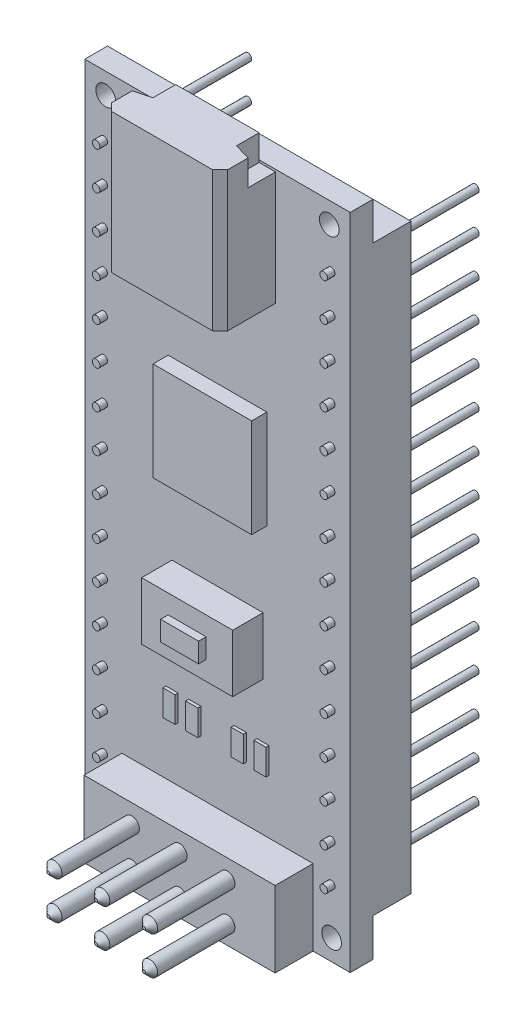
from build123d import *

# Parameters (mm, degrees)
ESQUISSE1_W             = 17.5
ESQUISSE1_H             = 43.4
BOSS_EXTRU_1_DEPTH      = 1.5
ESQUISSE2_W             = 7.65
ESQUISSE2_H             = 9.2
BOSS_EXTRU_2_DEPTH      = 3.65
ESQUISSE3_W             = 12.6
ESQUISSE3_H             = 5
BOSS_EXTRU_3_DEPTH      = 2.5
ESQUISSE4_W             = 2.5
ESQUISSE4_H             = 38.4
BOSS_EXTRU_4_DEPTH      = 2.5
BOSS_EXTRU_5_DEPTH      = 5.5
BOSS_EXTRU_5_DEPTH_BACK = 4.5
ESQUISSE5_R             = 0.25
ESQUISSE6_W             = 6.5
ESQUISSE6_H             = 6.5
BOSS_EXTRU_6_DEPTH      = 1
ESQUISSE7_W             = 6
ESQUISSE7_H             = 3.8
BOSS_EXTRU_9_DEPTH      = 2
ESQUISSE8_W             = 2.5
ESQUISSE8_H             = 1.3
BOSS_EXTRU_10_DEPTH     = 0.5
ESQUISSE9_W             = 0.8
ESQUISSE9_H             = 1.7
BOSS_EXTRU_11_DEPTH     = 0.2
ESQUISSE10_R            = 0.5
BOSS_EXTRU_12_DEPTH     = 5.5
CHANFREIN1_SIZE         = 0.4
ENL_V_MAT_EXTRU_1_DEPTH = 1.7
CHANFREIN2_SIZE         = 0.5
ESQUISSE12_R            = 0.65
ENL_V_MAT_EXTRU_2_DEPTH = 5.7
ESQUISSE13_W            = 5.5
ESQUISSE13_H            = 3
ESQUISSE13_W_2          = 3.5
ESQUISSE13_H_2          = 10
ESQUISSE13_W_3          = 1
ESQUISSE13_H_3          = 2
BOSS_EXTRU_13_DEPTH     = 1


with BuildPart() as part:
    # Esquisse1 → Boss.-Extru.1 (new body)
    with BuildSketch(Plane.XY):
        with Locations((-8.75, 21.7)):
            Rectangle(ESQUISSE1_W, ESQUISSE1_H)
    extrude(amount=BOSS_EXTRU_1_DEPTH)

    # Esquisse2 → Boss.-Extru.2 (add)
    with BuildSketch(Plane.XY.offset(1.5)):
        with Locations((-8.75, 40.35)):
            Rectangle(ESQUISSE2_W, ESQUISSE2_H)
    extrude(amount=BOSS_EXTRU_2_DEPTH)

    # Esquisse3 → Boss.-Extru.3 (add)
    with BuildSketch(Plane.XY.offset(1.5)):
        with Locations((-8.75, 2.5)):
            Rectangle(ESQUISSE3_W, ESQUISSE3_H)
    extrude(amount=BOSS_EXTRU_3_DEPTH)

    # Esquisse4 → Boss.-Extru.4 (add)
    with BuildSketch(Plane(origin=(0, 0, 0), x_dir=(-1, 0, 0), z_dir=(0, 0, -1))):
        with Locations((1.25, 21.7)):
            Rectangle(ESQUISSE4_W, ESQUISSE4_H)
        with Locations((16.25, 21.7)):
            Rectangle(ESQUISSE4_W, ESQUISSE4_H)
    extrude(amount=BOSS_EXTRU_4_DEPTH)

    # Esquisse5 → Boss.-Extru.5 (add, two sides: drawn at the far end of the back side and taken through both)
    with BuildSketch(Plane(origin=(0, 0, -2.5), x_dir=(-1, 0, 0), z_dir=(0, 0, -1)).offset(-BOSS_EXTRU_5_DEPTH_BACK)):
        with Locations((16.25, 39.4)):
            Circle(ESQUISSE5_R)
        with Locations((16.25, 36.9)):
            Circle(ESQUISSE5_R)
        with Locations((16.25, 34.4)):
            Circle(ESQUISSE5_R)
        with Locations((16.25, 31.9)):
            Circle(ESQUISSE5_R)
        with Locations((16.25, 29.4)):
            Circle(ESQUISSE5_R)
        with Locations((16.25, 26.9)):
            Circle(ESQUISSE5_R)
        with Locations((16.25, 24.4)):
            Circle(ESQUISSE5_R)
        with Locations((16.25, 21.9)):
            Circle(ESQUISSE5_R)
        with Locations((16.25, 19.4)):
            Circle(ESQUISSE5_R)
        with Locations((16.25, 16.9)):
            Circle(ESQUISSE5_R)
        with Locations((16.25, 14.4)):
            Circle(ESQUISSE5_R)
        with Locations((16.25, 11.9)):
            Circle(ESQUISSE5_R)
        with Locations((16.25, 9.4)):
            Circle(ESQUISSE5_R)
        with Locations((16.25, 6.9)):
            Circle(ESQUISSE5_R)
        with Locations((16.25, 4.4)):
            Circle(ESQUISSE5_R)
        with Locations((1.25, 4.4)):
            Circle(ESQUISSE5_R)
        with Locations((1.25, 6.9)):
            Circle(ESQUISSE5_R)
        with Locations((1.25, 9.4)):
            Circle(ESQUISSE5_R)
        with Locations((1.25, 11.9)):
            Circle(ESQUISSE5_R)
        with Locations((1.25, 14.4)):
            Circle(ESQUISSE5_R)
        with Locations((1.25, 16.9)):
            Circle(ESQUISSE5_R)
        with Locations((1.25, 19.4)):
            Circle(ESQUISSE5_R)
        with Locations((1.25, 21.9)):
            Circle(ESQUISSE5_R)
        with Locations((1.25, 24.4)):
            Circle(ESQUISSE5_R)
        with Locations((1.25, 26.9)):
            Circle(ESQUISSE5_R)
        with Locations((1.25, 29.4)):
            Circle(ESQUISSE5_R)
        with Locations((1.25, 31.9)):
            Circle(ESQUISSE5_R)
        with Locations((1.25, 34.4)):
            Circle(ESQUISSE5_R)
        with Locations((1.25, 36.9)):
            Circle(ESQUISSE5_R)
        with Locations((1.25, 39.4)):
            Circle(ESQUISSE5_R)
    extrude(amount=BOSS_EXTRU_5_DEPTH + BOSS_EXTRU_5_DEPTH_BACK)

    # Esquisse6 → Boss.-Extru.6 (add)
    with BuildSketch(Plane.XY.offset(1.5)):
        with Locations((-8.75, 26)):
            Rectangle(ESQUISSE6_W, ESQUISSE6_H)
    extrude(amount=BOSS_EXTRU_6_DEPTH)

    # Esquisse7 → Boss.-Extru.9 (add)
    with BuildSketch(Plane.XY.offset(1.5)):
        with Locations((-8.75, 15.773004759)):
            Rectangle(ESQUISSE7_W, ESQUISSE7_H)
    extrude(amount=BOSS_EXTRU_9_DEPTH)

    # Esquisse8 → Boss.-Extru.10 (add)
    with BuildSketch(Plane.XY.offset(3.5)):
        with Locations((-8.75, 15.773004759)):
            Rectangle(ESQUISSE8_W, ESQUISSE8_H)
    extrude(amount=BOSS_EXTRU_10_DEPTH)

    # Esquisse9 → Boss.-Extru.11 (add)
    with BuildSketch(Plane.XY.offset(1.5)):
        with Locations((-5.75, 9.43650238)):
            Rectangle(ESQUISSE9_W, ESQUISSE9_H)
        with Locations((-10.25, 9.43650238)):
            Rectangle(ESQUISSE9_W, ESQUISSE9_H)
        with Locations((-7.25, 9.43650238)):
            Rectangle(ESQUISSE9_W, ESQUISSE9_H)
        with Locations((-11.75, 9.43650238)):
            Rectangle(ESQUISSE9_W, ESQUISSE9_H)
    extrude(amount=BOSS_EXTRU_11_DEPTH)

    # Esquisse10 → Boss.-Extru.12 (add)
    with BuildSketch(Plane.XY.offset(4)):
        with Locations((-5.6, 1.25)):
            Circle(ESQUISSE10_R)
        with Locations((-5.6, 3.75)):
            Circle(ESQUISSE10_R)
        with Locations((-8.75, 3.75)):
            Circle(ESQUISSE10_R)
        with Locations((-11.9, 3.75)):
            Circle(ESQUISSE10_R)
        with Locations((-11.9, 1.25)):
            Circle(ESQUISSE10_R)
        with Locations((-8.75, 1.25)):
            Circle(ESQUISSE10_R)
    extrude(amount=BOSS_EXTRU_12_DEPTH)

    # Chanfrein1
    chanfrein1_edges = [part.edges().sort_by_distance(p)[0] for p in [
        (-12.4, 3.75, 9.5),
        (-12.4, 1.25, 9.5),
        (-9.25, 1.25, 9.5),
        (-9.25, 3.75, 9.5),
        (-6.1, 3.75, 9.5),
        (-6.1, 1.25, 9.5),
    ]]
    chamfer(chanfrein1_edges, length=CHANFREIN1_SIZE)

    # Esquisse11 → Enlèv. mat.-Extru.1 (cut)
    with BuildSketch(Plane(origin=(0, 44.95, 0), x_dir=(1, 0, 0), z_dir=(0, 1, 0))):
        Polygon((-6, -1.5), (-6, -3), (-4.925, -3.3), (-4.925, -1.5), align=None)
        Polygon((-11.5, -1.5), (-11.5, -3), (-12.575, -3.3), (-12.575, -1.5), align=None)
    extrude(amount=-ENL_V_MAT_EXTRU_1_DEPTH, mode=Mode.SUBTRACT)

    # Chanfrein2
    chanfrein2_edges = [part.edges().sort_by_distance(p)[0] for p in [
        (-12.575, 40.35, 5.15),
        (-4.925, 40.35, 5.15),
    ]]
    chamfer(chanfrein2_edges, length=CHANFREIN2_SIZE)

    # Esquisse12 → Enlèv. mat.-Extru.2 (cut)
    with BuildSketch(Plane.XY.offset(1.5)):
        with Locations((-16.275, 1.38)):
            Circle(ESQUISSE12_R)
        with Locations((-1.225, 1.38)):
            Circle(ESQUISSE12_R)
        with Locations((-16.12, 42.02)):
            Circle(ESQUISSE12_R)
        with Locations((-1.38, 42.02)):
            Circle(ESQUISSE12_R)
    extrude(amount=-ENL_V_MAT_EXTRU_2_DEPTH, mode=Mode.SUBTRACT)

    # Esquisse13 → Boss.-Extru.13 (add)
    with BuildSketch(Plane(origin=(0, 0, 0), x_dir=(-1, 0, 0), z_dir=(0, 0, -1))):
        with Locations((11.75, 8)):
            Rectangle(ESQUISSE13_W, ESQUISSE13_H)
        with Locations((7.25, 30.4)):
            Rectangle(ESQUISSE13_W_2, ESQUISSE13_H_2)
        with Locations((5.25, 40.9)):
            Rectangle(ESQUISSE13_W_3, ESQUISSE13_H)
        with Locations((7.25, 40.9)):
            Rectangle(ESQUISSE13_W_3, ESQUISSE13_H)
        with Locations((7.5, 8)):
            Rectangle(ESQUISSE13_W_3, ESQUISSE13_H)
        with Locations((11.25, 41.4)):
            Rectangle(ESQUISSE13_W_3, ESQUISSE13_H_3)
        with Locations((14.25, 41.4)):
            Rectangle(ESQUISSE13_W_3, ESQUISSE13_H_3)
        with Locations((3.25, 40.9)):
            Rectangle(ESQUISSE13_W_3, ESQUISSE13_H)
    extrude(amount=BOSS_EXTRU_13_DEPTH)


solid = part.part
